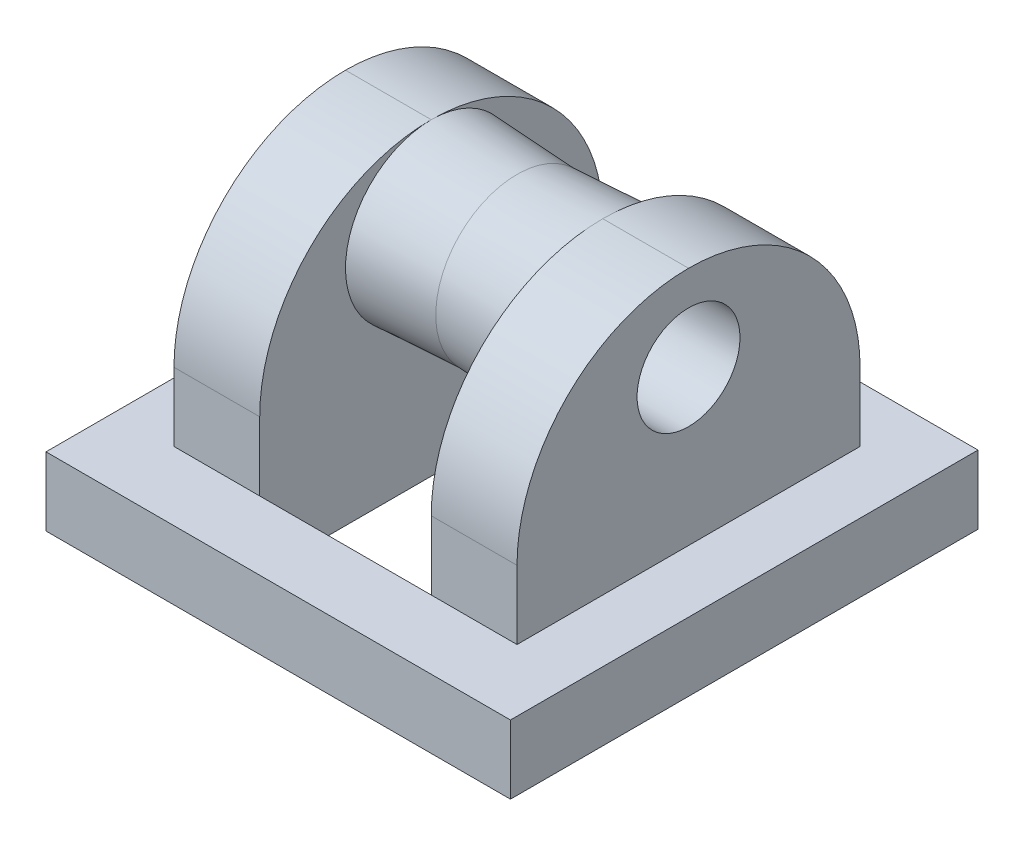
from build123d import *

# Parameters (mm, degrees)
BOSS_EXTRUDE1_DEPTH       = 20
SKETCH2_W                 = 20
SKETCH2_H                 = 30
CUT_EXTRUDE1_DEPTH        = 142.509716981
SHELL1_T                  = -2
SHELL1_THICKNESS_2_FACE_W = 20
SHELL1_THICKNESS_2_FACE_H = 18
SHELL1_THICKNESS_2_DEPTH  = 3
SHELL1_THICKNESS_3_FACE_W = 18
SHELL1_THICKNESS_3_FACE_H = 20
SHELL1_THICKNESS_3_DEPTH  = 3
SKETCH42_W                = 1.26968537
SKETCH42_H                = 30
BOSS_EXTRUDE16_DEPTH      = 15
SKETCH45_W                = 2
SKETCH45_H                = 30
BOSS_EXTRUDE17_DEPTH      = 15
CUT_EXTRUDE15_DEPTH       = 1
CUT_EXTRUDE15_DEPTH_BACK  = 51
SKETCH40_R                = 1.25
SKETCH41_W                = 8
SKETCH41_H                = 20
CUT_EXTRUDE16_DEPTH       = 10
SKETCH44_W                = 1
SKETCH44_H                = 5
CUT_EXTRUDE18_DEPTH       = 18
BOSS_EXTRUDE18_DEPTH      = 15
CUT_EXTRUDE19_DEPTH       = 44.5
CUT_EXTRUDE19_DEPTH_BACK  = 1
SKETCH47_R                = 1.1
SKETCH50_W                = 25
SKETCH50_H                = 2
BOSS_EXTRUDE19_DEPTH      = 15
SKETCH51_W                = 10.975395667
SKETCH51_H                = 2
BOSS_EXTRUDE20_DEPTH      = 15
BOSS_EXTRUDE21_DEPTH      = 5
CUT_EXTRUDE21_DEPTH       = 33.5
CUT_EXTRUDE21_DEPTH_BACK  = 1
SKETCH53_R                = 1.1
CUT_EXTRUDE14_REACH       = 107
SKETCH34_R                = 2.5
SKETCH3_W                 = 2.5
SKETCH3_H                 = 10
BOSS_EXTRUDE2_DEPTH       = 7
FILLET2_R                 = 5
CUT_EXTRUDE3_REACH        = 151.466
SKETCH6_R                 = 1.5
SKETCH21_R                = 2.5
SKETCH21_R_2              = 1.5
BOSS_EXTRUDE10_DEPTH      = 2.5
BOSS_EXTRUDE10_DRAFT      = 3
MIRROR7_COPY_1_SKETCH_R   = 2.5
MIRROR7_COPY_1_SKETCH_R_2 = 1.5
MIRROR7_COPY_1_DEPTH      = 2.5
MIRROR7_COPY_1_DRAFT      = 3
SKETCH26_W                = 5
SKETCH26_H                = 10
CUT_EXTRUDE8_DEPTH        = 2
SKETCH7_W                 = 2.5
SKETCH7_H                 = 10
BOSS_EXTRUDE4_DEPTH       = 5
FILLET4_R                 = 5
SKETCH22_R                = 2.5
BOSS_EXTRUDE11_DEPTH      = 2.5
BOSS_EXTRUDE11_TAPER      = 3
SKETCH23_R                = 1.5
CUT_EXTRUDE7_DEPTH        = 10
CUT_EXTRUDE9_REACH        = 143.51
SKETCH27_W                = 5
SKETCH27_H                = 10
SKETCH10_W                = 2.5
SKETCH10_H                = 10
BOSS_EXTRUDE6_DEPTH       = 5
FILLET6_R                 = 5
SKETCH28_R                = 2.5
BOSS_EXTRUDE12_DEPTH      = 2.5
BOSS_EXTRUDE12_TAPER      = 3
SKETCH29_R                = 1.5
CUT_EXTRUDE10_DEPTH       = 10
CUT_EXTRUDE11_REACH       = 139.477
SKETCH30_W                = 5
SKETCH30_H                = 10
SKETCH13_W                = 2.5
SKETCH13_H                = 10
BOSS_EXTRUDE8_DEPTH       = 5
FILLET8_R                 = 5
SKETCH31_R                = 2.5
BOSS_EXTRUDE13_DEPTH      = 2.5
BOSS_EXTRUDE13_TAPER      = 3
SKETCH32_R                = 1.5
CUT_EXTRUDE12_DEPTH       = 10
SKETCH33_W                = 5
SKETCH33_H                = 10
CUT_EXTRUDE13_DEPTH       = 2
SKETCH55_W                = 107.992137911
SKETCH55_H                = 152.047916128
CUT_EXTRUDE22_DEPTH       = 148.254881074
SKETCH57_W                = 24.522556922
SKETCH57_H                = 115.444687751
CUT_EXTRUDE23_DEPTH       = 148.254881074
CUT_EXTRUDE24_DEPTH       = 83.758685345


with BuildPart() as part:
    # Sketch1 → Boss-Extrude1 (new body)
    with BuildSketch(Plane.XY):
        Polygon((58, 114), (58, 115), (80, 115), (80, 20), (60, 0), (0, 0), (-10, 25), (-10, 105), (11, 105), (11, 110), (12, 110), (34, 110), (34, 115), (35, 115), (57, 115), (57, 114), align=None)
    extrude(amount=BOSS_EXTRUDE1_DEPTH)

    # Sketch2 → Cut-Extrude1 (cut, through all)
    with BuildSketch(Plane.XY.offset(20)):
        with Locations((70, 45)):
            Rectangle(SKETCH2_W, SKETCH2_H)
    extrude(amount=-CUT_EXTRUDE1_DEPTH, mode=Mode.SUBTRACT)

    # Shell1
    shell1_openings = [part.faces().sort_by_distance(p)[0] for p in [
        (33.373630802, 58.203978459, 20),
    ]]
    offset(amount=SHELL1_T, openings=shell1_openings, kind=Kind.INTERSECTION)

    # Shell1 thickness 2 face (on inner face of the shell) → Shell1 thickness 2 (add)
    with BuildSketch(Plane(origin=(68, 28, 11), x_dir=(1, 0, 0), z_dir=(0, 1, 0))):
        Rectangle(SHELL1_THICKNESS_2_FACE_W, SHELL1_THICKNESS_2_FACE_H)
    extrude(amount=-SHELL1_THICKNESS_2_DEPTH)

    # Shell1 thickness 3 face (on inner face of the shell) → Shell1 thickness 3 (add)
    with BuildSketch(Plane(origin=(68, 62, 11), x_dir=(0, 0, -1), z_dir=(0, -1, 0))):
        Rectangle(SHELL1_THICKNESS_3_FACE_W, SHELL1_THICKNESS_3_FACE_H)
    extrude(amount=-SHELL1_THICKNESS_3_DEPTH)

    # Sketch42 → Boss-Extrude16 (add)
    with BuildSketch(Plane.XY.offset(2)):
        with Locations((55.634842685, 97)):
            Rectangle(SKETCH42_W, SKETCH42_H)
    extrude(amount=BOSS_EXTRUDE16_DEPTH)

    # Sketch45 → Boss-Extrude17 (add)
    with BuildSketch(Plane.XY.offset(2)):
        with Locations((31.497271128, 93)):
            Rectangle(SKETCH45_W, SKETCH45_H)
    extrude(amount=BOSS_EXTRUDE17_DEPTH)

    # Sketch40 → Cut-Extrude15 (cut, two sides: drawn at the far end of the back side and taken through both)
    with BuildSketch(Plane(origin=(78, 0, 0), x_dir=(0, 0, -1), z_dir=(1, 0, 0)).offset(-CUT_EXTRUDE15_DEPTH_BACK)):
        with Locations(Location((-13.5, 105, 0), (0, 0, 90))):
            Circle(SKETCH40_R)
    extrude(amount=CUT_EXTRUDE15_DEPTH + CUT_EXTRUDE15_DEPTH_BACK, mode=Mode.SUBTRACT)

    # Sketch41 → Cut-Extrude16 (cut)
    with BuildSketch(Plane.ZY.offset(-58)):
        with Locations((11, 45)):
            Rectangle(SKETCH41_W, SKETCH41_H)
    extrude(amount=-CUT_EXTRUDE16_DEPTH, mode=Mode.SUBTRACT)

    # Sketch44 → Cut-Extrude18 (cut)
    with BuildSketch(Plane.XY.offset(20)):
        with Locations((35.5, 110.5)):
            Rectangle(SKETCH44_W, SKETCH44_H)
    extrude(amount=-CUT_EXTRUDE18_DEPTH, mode=Mode.SUBTRACT)

    # Sketch46 → Boss-Extrude18 (add)
    with BuildSketch(Plane.XY.offset(2)):
        Polygon((12.078813568, 88), (12.078813568, 89), (16.75, 89), (16.75, 79), (15.75, 79), (15.75, 88), align=None)
    extrude(amount=BOSS_EXTRUDE18_DEPTH)

    # Sketch47 → Cut-Extrude19 (cut, two sides: drawn at the far end of the back side and taken through both)
    with BuildSketch(Plane(origin=(-8, 0, 0), x_dir=(0, 0, -1), z_dir=(1, 0, 0)).offset(-CUT_EXTRUDE19_DEPTH_BACK)):
        with Locations(Location((-13.5, 95, 0), (0, 0, 270))):
            Circle(SKETCH47_R)
    extrude(amount=CUT_EXTRUDE19_DEPTH + CUT_EXTRUDE19_DEPTH_BACK, mode=Mode.SUBTRACT)

    # Sketch50 → Boss-Extrude19 (add)
    with BuildSketch(Plane.XY.offset(2)):
        with Locations((45.5, 58.4)):
            Rectangle(SKETCH50_W, SKETCH50_H)
    extrude(amount=BOSS_EXTRUDE19_DEPTH)

    # Sketch51 → Boss-Extrude20 (add)
    with BuildSketch(Plane.XY.offset(2)):
        with Locations((52.512302167, 34)):
            Rectangle(SKETCH51_W, SKETCH51_H)
    extrude(amount=BOSS_EXTRUDE20_DEPTH)

    # Sketch52 → Boss-Extrude21 (add)
    with BuildSketch(Plane.XY.offset(2)):
        Polygon((42.748392928, 49.4), (43.748392928, 49.4), (43.748392928, 44.4), (33.748392928, 44.4), (33.748392928, 45.4), (42.748392928, 45.4), align=None)
        Polygon((40.497271128, 97.212593004), (40.497271128, 98.212593004), (45.497271128, 98.212593004), (45.497271128, 88.212593004), (44.497271128, 88.226881517), (44.497271128, 97.212593004), align=None)
        Polygon((64.269685369, 97.226881517), (64.269685369, 98.226881517), (69.269685369, 98.226881517), (69.269685369, 88.226881517), (68.269685369, 88.226881517), (68.269685369, 97.226881517), align=None)
    extrude(amount=BOSS_EXTRUDE21_DEPTH)

    # Sketch53 → Cut-Extrude21 (cut, two sides: drawn at the far end of the back side and taken through both)
    with BuildSketch(Plane.XZ.offset(-57.4).offset(-CUT_EXTRUDE21_DEPTH_BACK)):
        with Locations(Location((49, 13.5, 0), (0, 0, 270))):
            Circle(SKETCH53_R)
    extrude(amount=CUT_EXTRUDE21_DEPTH + CUT_EXTRUDE21_DEPTH_BACK, mode=Mode.SUBTRACT)

    # Cut-Extrude14: up to this face of the body (flat: up to its plane)
    cut_extrude14_end = Plane(part.part.faces().sort_by_distance((68, 25, 11))[0])
    # Sketch34 → Cut-Extrude14 (cut, up to the picked face)
    with BuildSketch(Plane(origin=(0, 65, 0), x_dir=(1, 0, 0), z_dir=(0, 1, 0)), mode=Mode.PRIVATE) as cut_extrude14_sk1:
        with Locations(Location((70, -11, 0), (0, 0, 270))):
            Circle(SKETCH34_R)
    cut_extrude14_tool1 = split(extrude(cut_extrude14_sk1.sketch, amount=-CUT_EXTRUDE14_REACH, mode=Mode.PRIVATE), bisect_by=cut_extrude14_end, keep=Keep.BOTH, mode=Mode.PRIVATE)
    add(cut_extrude14_tool1.solids().sort_by(Axis((70, 65, 11), (0, -1, 0)))[0], mode=Mode.SUBTRACT)

    # Sketch3 → Boss-Extrude2 (add)
    with BuildSketch(Plane(origin=(0, 115, 0), x_dir=(1, 0, 0), z_dir=(0, 1, 0))):
        with Locations((65.25, -13)):
            Rectangle(SKETCH3_W, SKETCH3_H)
        with Locations((72.75, -13)):
            Rectangle(SKETCH3_W, SKETCH3_H)
    extrude(amount=BOSS_EXTRUDE2_DEPTH)

    # Fillet2
    fillet2_edges = [part.edges().sort_by_distance(p)[0] for p in [
        (65.25, 122, 8),
        (65.25, 122, 18),
        (72.75, 122, 8),
        (72.75, 122, 18),
    ]]
    fillet(fillet2_edges, radius=FILLET2_R - 0.0001)  # a hair under: the kernel refuses the full size

    # Cut-Extrude3: up to this face of the body (flat: up to its plane)
    cut_extrude3_end = Plane(part.part.faces().sort_by_distance((64, 118.068574318, 13))[0])
    # Sketch6 → Cut-Extrude3 (cut, up to the picked face)
    with BuildSketch(Plane(origin=(74, 0, 0), x_dir=(0, 0, -1), z_dir=(1, 0, 0)), mode=Mode.PRIVATE) as cut_extrude3_sk1:
        with Locations((-13, 119.5)):
            Circle(SKETCH6_R)
    cut_extrude3_tool1 = split(extrude(cut_extrude3_sk1.sketch, amount=-CUT_EXTRUDE3_REACH, mode=Mode.PRIVATE), bisect_by=cut_extrude3_end, keep=Keep.BOTH, mode=Mode.PRIVATE)
    add(cut_extrude3_tool1.solids().sort_by(Axis((74, 119.5, 13), (-1, 0, 0)))[0], mode=Mode.SUBTRACT)


with BuildPart() as boss_extrude10_tool:
    # Sketch21 → Boss-Extrude10 (with draft: the straight prism first)
    with BuildSketch(Plane(origin=(66.5, 0, 0), x_dir=(0, 0, -1), z_dir=(1, 0, 0))):
        with Locations((-13, 119.5)):
            Circle(SKETCH21_R)
        with Locations((-13, 119.5)):
            Circle(SKETCH21_R_2, mode=Mode.SUBTRACT)
    extrude(amount=BOSS_EXTRUDE10_DEPTH)
    # Boss-Extrude10: the draft: its side faces are tilted about the plane it starts from
    boss_extrude10_sides = [boss_extrude10_tool.faces().sort_by_distance(p)[0] for p in [
        (67.75, 119.5, 15.5),
        (67.75, 119.5, 14.5),
    ]]
    draft(boss_extrude10_sides, Plane(origin=(66.5, 0, 0), x_dir=(0, 0, -1), z_dir=(1, 0, 0)), BOSS_EXTRUDE10_DRAFT)


with BuildPart() as part_1:
    add(part.part)

    # Boss-Extrude10: add boss_extrude10_tool
    add(boss_extrude10_tool.part)


with BuildPart() as mirror7_copy_1_tool:
    # Mirror7 copy 1 sketch → Mirror7 copy 1 (with draft: the straight prism first)
    with BuildSketch(Plane(origin=(71.5, 0, 0), x_dir=(0, 0, -1), z_dir=(-1, 0, 0))):
        with Locations((-13, -119.5)):
            Circle(MIRROR7_COPY_1_SKETCH_R)
        with Locations((-13, -119.5)):
            Circle(MIRROR7_COPY_1_SKETCH_R_2, mode=Mode.SUBTRACT)
    extrude(amount=MIRROR7_COPY_1_DEPTH)
    # Mirror7 copy 1: the draft: its side faces are tilted about the plane it starts from
    mirror7_copy_1_sides = [mirror7_copy_1_tool.faces().sort_by_distance(p)[0] for p in [
        (70.25, 119.5, 15.5),
        (70.25, 119.5, 14.5),
    ]]
    draft(mirror7_copy_1_sides, Plane(origin=(71.5, 0, 0), x_dir=(0, 0, -1), z_dir=(-1, 0, 0)), MIRROR7_COPY_1_DRAFT)


with BuildPart() as part_2:
    add(part_1.part)

    # Mirror7 copy 1: add mirror7_copy_1_tool
    add(mirror7_copy_1_tool.part)

    # Sketch26 → Cut-Extrude8 (cut)
    with BuildSketch(Plane(origin=(0, 115, 0), x_dir=(1, 0, 0), z_dir=(0, 1, 0))):
        with Locations((69, -13)):
            Rectangle(SKETCH26_W, SKETCH26_H)
    extrude(amount=-CUT_EXTRUDE8_DEPTH, mode=Mode.SUBTRACT)

    # Sketch7 → Boss-Extrude4 (add)
    with BuildSketch(Plane(origin=(0, 115, 0), x_dir=(1, 0, 0), z_dir=(0, 1, 0))):
        with Locations((41.25, -13)):
            Rectangle(SKETCH7_W, SKETCH7_H)
        with Locations((48.75, -13)):
            Rectangle(SKETCH7_W, SKETCH7_H)
    extrude(amount=BOSS_EXTRUDE4_DEPTH)

    # Fillet4
    fillet4_edges = [part_2.edges().sort_by_distance(p)[0] for p in [
        (41.25, 120, 8),
        (41.25, 120, 18),
        (48.75, 120, 8),
        (48.75, 120, 18),
    ]]
    fillet(fillet4_edges, radius=FILLET4_R - 0.0001)  # a hair under: the kernel refuses the full size

    # Sketch22 → Boss-Extrude11 (add)
    with BuildSketch(Plane(origin=(42.5, 0, 0), x_dir=(0, 0, -1), z_dir=(1, 0, 0))):
        with Locations((-13, 117.5)):
            Circle(SKETCH22_R)
    boss_extrude11 = extrude(amount=BOSS_EXTRUDE11_DEPTH, taper=BOSS_EXTRUDE11_TAPER)

    # Mirror8: Boss-Extrude11 across plane
    add(boss_extrude11.mirror(Plane(origin=(45, 117.5, 13), x_dir=(0, 0, 1), z_dir=(1, 0, 0))))

    # Sketch23 → Cut-Extrude7 (cut)
    with BuildSketch(Plane(origin=(50, 0, 0), x_dir=(0, 0, -1), z_dir=(1, 0, 0))):
        with Locations(Location((-13, 117.5, 0), (0, 0, 90))):
            Circle(SKETCH23_R)
    extrude(amount=-CUT_EXTRUDE7_DEPTH, mode=Mode.SUBTRACT)

    # Sketch27 → Cut-Extrude9 (cut, up to next)
    with BuildSketch(Plane(origin=(0, 115, 0), x_dir=(1, 0, 0), z_dir=(0, 1, 0)), mode=Mode.PRIVATE) as cut_extrude9_sk1:
        with Locations((45, -13)):
            Rectangle(SKETCH27_W, SKETCH27_H)
    cut_extrude9_tool1 = extrude(cut_extrude9_sk1.sketch, amount=-CUT_EXTRUDE9_REACH, mode=Mode.PRIVATE) & part_2.part
    add(cut_extrude9_tool1.solids().sort_by_distance((45, 115, 13))[0], mode=Mode.SUBTRACT)

    # Sketch10 → Boss-Extrude6 (add)
    with BuildSketch(Plane(origin=(0, 110, 0), x_dir=(1, 0, 0), z_dir=(0, 1, 0))):
        with Locations((19.25, -13)):
            Rectangle(SKETCH10_W, SKETCH10_H)
        with Locations((26.75, -13)):
            Rectangle(SKETCH10_W, SKETCH10_H)
    extrude(amount=BOSS_EXTRUDE6_DEPTH)

    # Fillet6
    fillet6_edges = [part_2.edges().sort_by_distance(p)[0] for p in [
        (19.25, 115, 18),
        (19.25, 115, 8),
        (26.75, 115, 8),
        (26.75, 115, 18),
    ]]
    fillet(fillet6_edges, radius=FILLET6_R - 0.0001)  # a hair under: the kernel refuses the full size

    # Sketch28 → Boss-Extrude12 (add)
    with BuildSketch(Plane(origin=(20.5, 0, 0), x_dir=(0, 0, -1), z_dir=(1, 0, 0))):
        with Locations((-13, 112.5)):
            Circle(SKETCH28_R)
    boss_extrude12 = extrude(amount=BOSS_EXTRUDE12_DEPTH, taper=BOSS_EXTRUDE12_TAPER)

    # Mirror9: Boss-Extrude12 across plane
    add(boss_extrude12.mirror(Plane(origin=(23, 112.5, 13), x_dir=(0, 0, 1), z_dir=(1, 0, 0))))

    # Sketch29 → Cut-Extrude10 (cut)
    with BuildSketch(Plane(origin=(28, 0, 0), x_dir=(0, 0, -1), z_dir=(1, 0, 0))):
        with Locations((-13, 112.5)):
            Circle(SKETCH29_R)
    extrude(amount=-CUT_EXTRUDE10_DEPTH, mode=Mode.SUBTRACT)

    # Sketch30 → Cut-Extrude11 (cut, up to next)
    with BuildSketch(Plane(origin=(0, 110, 0), x_dir=(1, 0, 0), z_dir=(0, 1, 0)), mode=Mode.PRIVATE) as cut_extrude11_sk1:
        with Locations((23, -13)):
            Rectangle(SKETCH30_W, SKETCH30_H)
    cut_extrude11_tool1 = extrude(cut_extrude11_sk1.sketch, amount=-CUT_EXTRUDE11_REACH, mode=Mode.PRIVATE) & part_2.part
    add(cut_extrude11_tool1.solids().sort_by_distance((23, 110, 13))[0], mode=Mode.SUBTRACT)

    # Sketch13 → Boss-Extrude8 (add)
    with BuildSketch(Plane(origin=(0, 105, 0), x_dir=(1, 0, 0), z_dir=(0, 1, 0))):
        with Locations((-2.75, -13)):
            Rectangle(SKETCH13_W, SKETCH13_H)
        with Locations((4.75, -13)):
            Rectangle(SKETCH13_W, SKETCH13_H)
    extrude(amount=BOSS_EXTRUDE8_DEPTH)

    # Fillet8
    fillet8_edges = [part_2.edges().sort_by_distance(p)[0] for p in [
        (-2.75, 110, 18),
        (-2.75, 110, 8),
        (4.75, 110, 8),
        (4.75, 110, 18),
    ]]
    fillet(fillet8_edges, radius=FILLET8_R - 0.0001)  # a hair under: the kernel refuses the full size

    # Sketch31 → Boss-Extrude13 (add)
    with BuildSketch(Plane(origin=(-1.5, 0, 0), x_dir=(0, 0, -1), z_dir=(1, 0, 0))):
        with Locations((-13, 107.5)):
            Circle(SKETCH31_R)
    boss_extrude13 = extrude(amount=BOSS_EXTRUDE13_DEPTH, taper=BOSS_EXTRUDE13_TAPER)

    # Mirror10: Boss-Extrude13 across plane
    add(boss_extrude13.mirror(Plane(origin=(1, 107.5, 13), x_dir=(0, 0, 1), z_dir=(1, 0, 0))))

    # Sketch32 → Cut-Extrude12 (cut)
    with BuildSketch(Plane(origin=(6, 0, 0), x_dir=(0, 0, -1), z_dir=(1, 0, 0))):
        with Locations((-13, 107.5)):
            Circle(SKETCH32_R)
    extrude(amount=-CUT_EXTRUDE12_DEPTH, mode=Mode.SUBTRACT)

    # Sketch33 → Cut-Extrude13 (cut)
    with BuildSketch(Plane(origin=(0, 105, 0), x_dir=(1, 0, 0), z_dir=(0, 1, 0))):
        with Locations((1, -13)):
            Rectangle(SKETCH33_W, SKETCH33_H)
    extrude(amount=-CUT_EXTRUDE13_DEPTH, mode=Mode.SUBTRACT)

    # Sketch55 → Cut-Extrude22 (cut, through all)
    with BuildSketch(Plane(origin=(0, 0, 0), x_dir=(-1, 0, 0), z_dir=(0, 0, -1))):
        with Locations((-8.273574449, 59.296747854)):
            Rectangle(SKETCH55_W, SKETCH55_H)
    extrude(amount=-CUT_EXTRUDE22_DEPTH, mode=Mode.SUBTRACT)


with BuildPart() as cut_extrude22_piece_1:
    # of the separate pieces the step leaves, piece 1, a body of its own (cut_extrude22_pieces)
    add(part_2.part.solids().sort_by_distance((62.269643405, 60, 0))[0])


with BuildPart() as cut_extrude22_piece_2:
    # of the separate pieces the step leaves, piece 2, a body of its own (cut_extrude22_pieces)
    add(part_2.part.solids().sort_by_distance((62.269643405, 2.269643405, 0))[0])


with BuildPart() as cut_extrude23_tool:
    # Sketch57 → Cut-Extrude23 (new, through all)
    with BuildSketch(Plane(origin=(0, 0, 0), x_dir=(-1, 0, 0), z_dir=(0, 0, -1))):
        with Locations((-74.530921866, 55.277656124)):
            Rectangle(SKETCH57_W, SKETCH57_H)
    extrude(amount=-CUT_EXTRUDE23_DEPTH)


with BuildPart() as cut_extrude22_piece_1_1:
    add(cut_extrude22_piece_1.part)

    # Cut-Extrude23: cut by cut_extrude23_tool
    add(cut_extrude23_tool.part, mode=Mode.SUBTRACT)

    # Sketch58 → Cut-Extrude24 (cut, through all)
    with BuildSketch(Plane(origin=(0, 115, 0), x_dir=(1, 0, 0), z_dir=(0, 1, 0))):
        Polygon((80, 0), (62.269643405, 0), (62.269643405, -6.370932132), (75.808765206, -6.370932132), (75.808765206, -20), (80, -20), (80, -6.370932132), align=None)
    extrude(amount=-CUT_EXTRUDE24_DEPTH, mode=Mode.SUBTRACT)


with BuildPart() as cut_extrude22_piece_2_1:
    add(cut_extrude22_piece_2.part)

    # Cut-Extrude23: cut by cut_extrude23_tool
    add(cut_extrude23_tool.part, mode=Mode.SUBTRACT)


solid = cut_extrude22_piece_1_1.part
